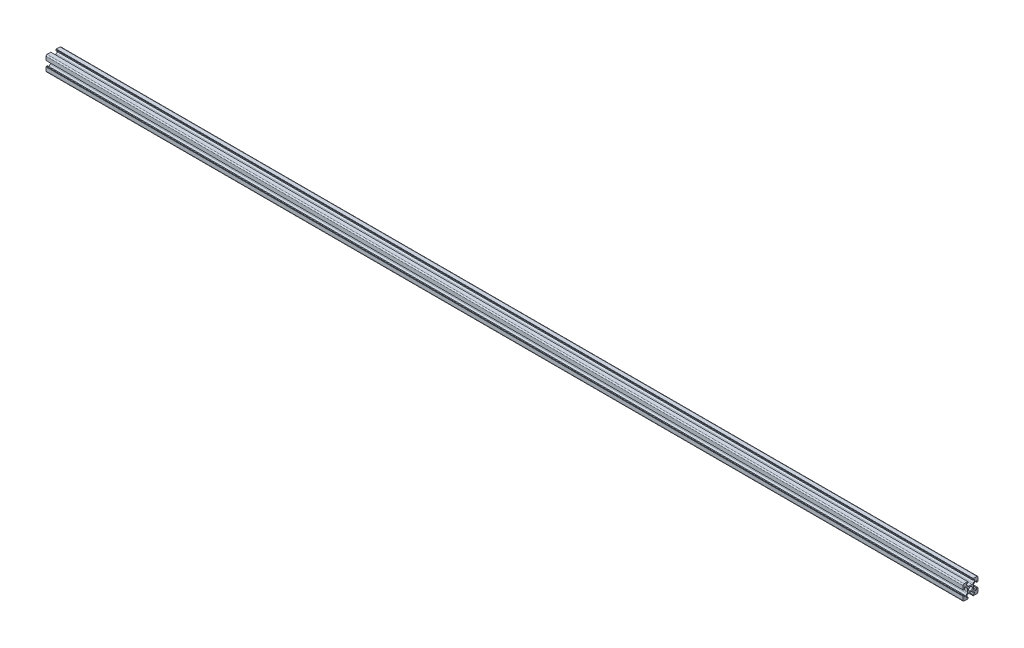
from build123d import *

# Parameters (mm, degrees)
SKETCH2_R           = 2.5
BOSS_EXTRUDE1_DEPTH = 609.6


with BuildPart() as part:
    # Sketch2 → Boss-Extrude1 (new, symmetric)
    with BuildSketch(Plane.YZ):
        with BuildLine():
            Line((-10, 3.6), (-9.5, 3.6))
            Line((-9.5, 3.6), (-9.5, 3.1))
            Line((-9.5, 3.1), (-8.2, 3.1))
            Line((-8.2, 3.1), (-8.2, 5.5))
            Line((-8.2, 5.5), (-6.560660172, 5.5))
            Line((-6.560660172, 5.5), (-4.485786438, 3.425126266))
            ThreePointArc((-4.485786438, 3.425126266), (-4.052240935, 2.776279568), (-3.9, 2.010912703))
            Line((-3.9, 2.010912703), (-3.9, -2.010912703))
            ThreePointArc((-3.9, -2.010912703), (-4.052240935, -2.776279568), (-4.485786438, -3.425126266))
            Line((-4.485786438, -3.425126266), (-6.560660172, -5.5))
            Line((-6.560660172, -5.5), (-8.2, -5.5))
            Line((-8.2, -5.5), (-8.2, -3.1))
            Line((-8.2, -3.1), (-9.5, -3.1))
            Line((-9.5, -3.1), (-9.5, -3.6))
            Line((-9.5, -3.6), (-10, -3.6))
            Line((-10, -3.6), (-10, -8.5))
            ThreePointArc((-10, -8.5), (-9.560660172, -9.560660172), (-8.5, -10))
            Line((-8.5, -10), (-3.6, -10))
            Line((-3.6, -10), (-3.6, -9.5))
            Line((-3.6, -9.5), (-3.1, -9.5))
            Line((-3.1, -9.5), (-3.1, -8.2))
            Line((-3.1, -8.2), (-5.5, -8.2))
            Line((-5.5, -8.2), (-5.5, -6.560660172))
            Line((-5.5, -6.560660172), (-3.425126266, -4.485786438))
            ThreePointArc((-3.425126266, -4.485786438), (-2.776279568, -4.052240935), (-2.010912703, -3.9))
            Line((-2.010912703, -3.9), (2.010912703, -3.9))
            ThreePointArc((2.010912703, -3.9), (2.776279568, -4.052240935), (3.425126266, -4.485786438))
            Line((3.425126266, -4.485786438), (5.5, -6.560660172))
            Line((5.5, -6.560660172), (5.5, -8.2))
            Line((5.5, -8.2), (3.1, -8.2))
            Line((3.1, -8.2), (3.1, -9.5))
            Line((3.1, -9.5), (3.6, -9.5))
            Line((3.6, -9.5), (3.6, -10))
            Line((3.6, -10), (8.5, -10))
            ThreePointArc((8.5, -10), (9.560660172, -9.560660172), (10, -8.5))
            Line((10, -8.5), (10, -3.6))
            Line((10, -3.6), (9.5, -3.6))
            Line((9.5, -3.6), (9.5, -3.1))
            Line((9.5, -3.1), (8.2, -3.1))
            Line((8.2, -3.1), (8.2, -5.5))
            Line((8.2, -5.5), (6.560660172, -5.5))
            Line((6.560660172, -5.5), (4.485786438, -3.425126266))
            ThreePointArc((4.485786438, -3.425126266), (4.052240935, -2.776279568), (3.9, -2.010912703))
            Line((3.9, -2.010912703), (3.9, 2.010912703))
            ThreePointArc((3.9, 2.010912703), (4.052240935, 2.776279568), (4.485786438, 3.425126266))
            Line((4.485786438, 3.425126266), (6.560660172, 5.5))
            Line((6.560660172, 5.5), (8.2, 5.5))
            Line((8.2, 5.5), (8.2, 3.1))
            Line((8.2, 3.1), (9.5, 3.1))
            Line((9.5, 3.1), (9.5, 3.6))
            Line((9.5, 3.6), (10, 3.6))
            Line((10, 3.6), (10, 8.5))
            ThreePointArc((10, 8.5), (9.560660172, 9.560660172), (8.5, 10))
            Line((8.5, 10), (3.6, 10))
            Line((3.6, 10), (3.6, 9.5))
            Line((3.6, 9.5), (3.1, 9.5))
            Line((3.1, 9.5), (3.1, 8.2))
            Line((3.1, 8.2), (5.5, 8.2))
            Line((5.5, 8.2), (5.5, 6.560660172))
            Line((5.5, 6.560660172), (3.425126266, 4.485786438))
            ThreePointArc((3.425126266, 4.485786438), (2.776279568, 4.052240935), (2.010912703, 3.9))
            Line((2.010912703, 3.9), (-2.010912703, 3.9))
            ThreePointArc((-2.010912703, 3.9), (-2.776279568, 4.052240935), (-3.425126266, 4.485786438))
            Line((-3.425126266, 4.485786438), (-5.5, 6.560660172))
            Line((-5.5, 6.560660172), (-5.5, 8.2))
            Line((-5.5, 8.2), (-3.1, 8.2))
            Line((-3.1, 8.2), (-3.1, 9.5))
            Line((-3.1, 9.5), (-3.6, 9.5))
            Line((-3.6, 9.5), (-3.6, 10))
            Line((-3.6, 10), (-8.5, 10))
            ThreePointArc((-8.5, 10), (-9.560660172, 9.560660172), (-10, 8.5))
            Line((-10, 8.5), (-10, 3.6))
        make_face()
        Circle(SKETCH2_R, mode=Mode.SUBTRACT)
    extrude(amount=BOSS_EXTRUDE1_DEPTH, both=True)


solid = part.part
